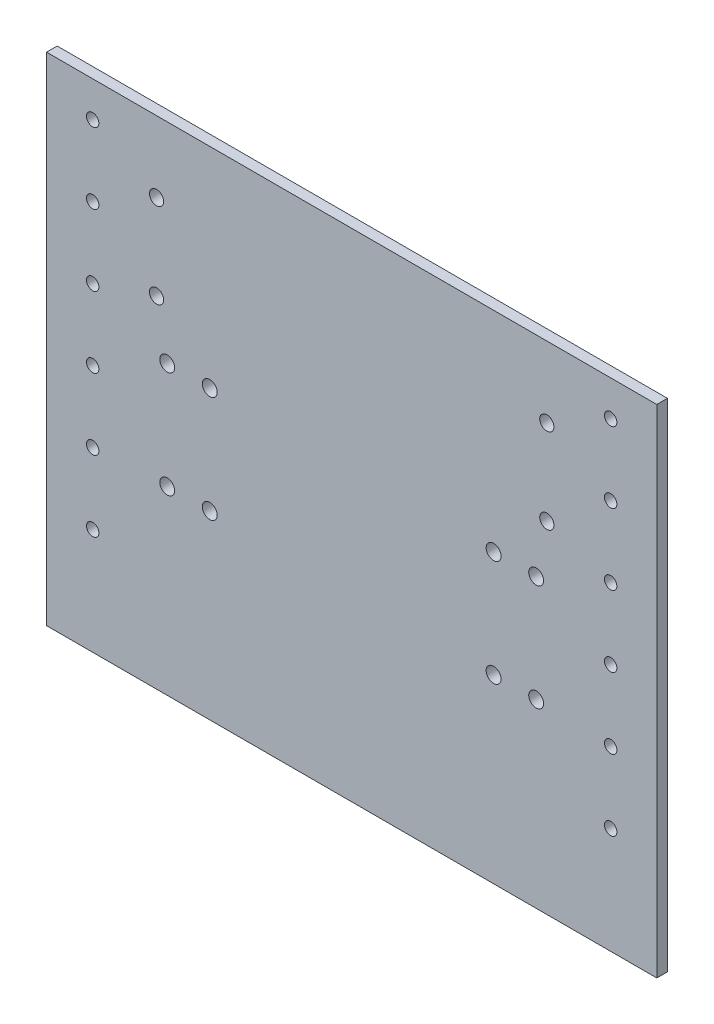
from build123d import *

# Parameters (mm, degrees)
SKETCH_1_W          = 172
SKETCH_1_H          = 140
EXTRUDE_1_DEPTH     = 3
SKETCH_2_R          = 2
CUT_EXTRUDE_1_DEPTH = 37
SKETCH_3_R          = 2.1
CUT_EXTRUDE_2_DEPTH = 10
SKETCH_4_R          = 1.75
CUT_EXTRUDE_3_DEPTH = 10


with BuildPart() as part:
    # 草图1 → 凸台-拉伸1 (new body)
    with BuildSketch(Plane.XY):
        with Locations((86, -70)):
            Rectangle(SKETCH_1_W, SKETCH_1_H)
    extrude(amount=EXTRUDE_1_DEPTH)

    # 草图2 → 切除-拉伸1 (cut)
    with BuildSketch(Plane.XY.offset(3)):
        with Locations((31, -20)):
            Circle(SKETCH_2_R)
        with Locations((31, -44)):
            Circle(SKETCH_2_R)
        with Locations((141, -44)):
            Circle(SKETCH_2_R)
        with Locations((141, -20)):
            Circle(SKETCH_2_R)
    extrude(amount=-CUT_EXTRUDE_1_DEPTH, mode=Mode.SUBTRACT)

    # 草图3 → 切除-拉伸2 (cut)
    with BuildSketch(Plane.XY.offset(3)):
        with Locations((34, -59)):
            Circle(SKETCH_3_R)
        with Locations((46, -59)):
            Circle(SKETCH_3_R)
        with Locations((34, -89)):
            Circle(SKETCH_3_R)
        with Locations((46, -89)):
            Circle(SKETCH_3_R)
        with Locations((126, -89)):
            Circle(SKETCH_3_R)
        with Locations((138, -89)):
            Circle(SKETCH_3_R)
        with Locations((126, -59)):
            Circle(SKETCH_3_R)
        with Locations((138, -59)):
            Circle(SKETCH_3_R)
    extrude(amount=-CUT_EXTRUDE_2_DEPTH, mode=Mode.SUBTRACT)

    # 草图4 → 切除-拉伸3 (cut)
    with BuildSketch(Plane.XY.offset(3)):
        with Locations((13, -10)):
            Circle(SKETCH_4_R)
        with Locations((13, -30)):
            Circle(SKETCH_4_R)
        with Locations((13, -50)):
            Circle(SKETCH_4_R)
        with Locations((13, -70)):
            Circle(SKETCH_4_R)
        with Locations((13, -90)):
            Circle(SKETCH_4_R)
        with Locations((13, -110)):
            Circle(SKETCH_4_R)
        with Locations((159, -110)):
            Circle(SKETCH_4_R)
        with Locations((159, -90)):
            Circle(SKETCH_4_R)
        with Locations((159, -70)):
            Circle(SKETCH_4_R)
        with Locations((159, -50)):
            Circle(SKETCH_4_R)
        with Locations((159, -30)):
            Circle(SKETCH_4_R)
        with Locations((159, -10)):
            Circle(SKETCH_4_R)
    extrude(amount=-CUT_EXTRUDE_3_DEPTH, mode=Mode.SUBTRACT)


solid = part.part
